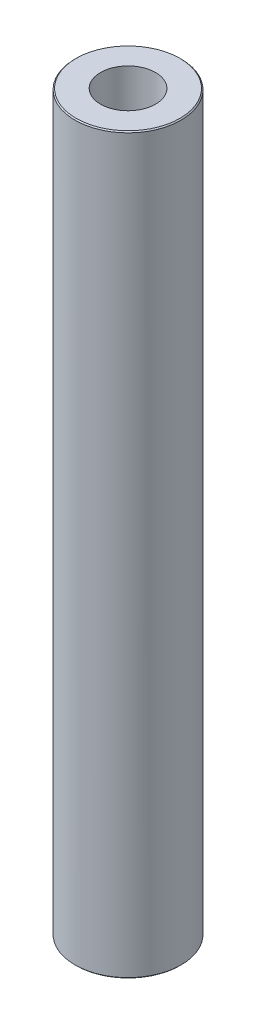
from build123d import *
from OCP.BRepFilletAPI import BRepFilletAPI_MakeChamfer

# Parameters (mm, degrees)
SKETCH1_R           = 17.5
BOSS_EXTRUDE1_DEPTH = 242.129487455
SKETCH2_R           = 9.075583425
CUT_EXTRUDE1_DEPTH  = 244.391020161
CHAMFER1_SIZE       = 0.356146254
CHAMFER1_SIZE2      = 0.358221701


with BuildPart() as part:
    # Sketch1 → Boss-Extrude1 (new body)
    with BuildSketch(Plane(origin=(0, 0, 0), x_dir=(1, 0, 0), z_dir=(0, 1, 0))):
        Circle(SKETCH1_R)
    extrude(amount=BOSS_EXTRUDE1_DEPTH)

    # Sketch2 → Cut-Extrude1 (cut, through all)
    with BuildSketch(Plane(origin=(0, 0, 0), x_dir=(1, 0, 0), z_dir=(0, 1, 0))):
        Circle(SKETCH2_R)
    extrude(amount=CUT_EXTRUDE1_DEPTH, mode=Mode.SUBTRACT)

    # Chamfer1: one chamfer whose edges measure the first distance from different faces: ONE call of the kernel's chamfer builder (chamfer() names one face for all edges)
    chamfer1_edges_1 = [part.edges().sort_by_distance(p)[0] for p in [
        (-17.5, 242.129487455, 0),
    ]]
    chamfer1_side_1 = [part.faces().sort_by_distance(p)[0] for p in [
        (-17.5, 121.064743727, 0),
    ]]
    chamfer1_edges_2 = [part.edges().sort_by_distance(p)[0] for p in [
        (-17.5, 0, 0),
    ]]
    chamfer1_side_2 = [part.faces().sort_by_distance(p)[0] for p in [
        (-17.005025253, 0, 0),
    ]]
    chamfer1 = BRepFilletAPI_MakeChamfer(part.part.solid().wrapped)
    for e in chamfer1_edges_1:
        chamfer1.Add(CHAMFER1_SIZE, CHAMFER1_SIZE2, e.wrapped, chamfer1_side_1[0].wrapped)  # the first distance lies on this face
    for e in chamfer1_edges_2:
        chamfer1.Add(CHAMFER1_SIZE, CHAMFER1_SIZE2, e.wrapped, chamfer1_side_2[0].wrapped)  # the first distance lies on this face
    add(Compound.cast(chamfer1.Shape()), mode=Mode.REPLACE)


solid = part.part
